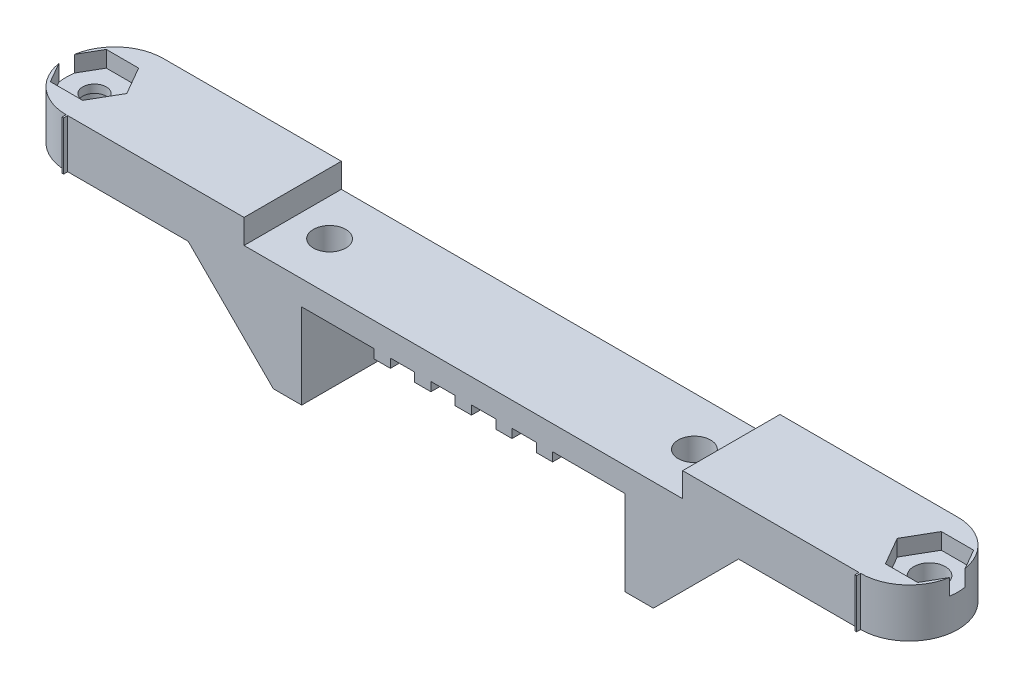
from build123d import *

# Parameters (mm, degrees)
SKETCH1_R                 = 1.95
BOSS_EXTRUDE1_DEPTH       = 3
SKETCH4_W                 = 3.5
SKETCH4_H                 = 12
BOSS_EXTRUDE3_DEPTH       = 10.5
SKETCH5_W                 = 2
SKETCH5_H                 = 12
BOSS_EXTRUDE4_DEPTH       = 1.1
SKETCH6_W                 = 0.2
SKETCH6_H                 = 3
BOSS_EXTRUDE5_DEPTH       = 0.5
CHAMFER1_SIZE             = 10.5
BOSS_EXTRUDE6_OUTLINE_R   = 1.95
BOSS_EXTRUDE6_OUTLINE_R_2 = 1.45
BOSS_EXTRUDE6_DEPTH       = 3
CUT_EXTRUDE1_START        = -2
SKETCH11_R                = 1.45
CUT_EXTRUDE1_DEPTH        = 2
SKETCH13_R                = 2
CUT_EXTRUDE2_DEPTH        = 8


# Read off the part's stored shape, not the designer's step: Boss-Extrude6
with BuildPart() as part:
    # Sketch1 → Boss-Extrude1 (new body)
    with BuildSketch(Plane(origin=(0, 0, 0), x_dir=(1, 0, 0), z_dir=(0, 1, 0))):
        with BuildLine():
            Line((-49, 6), (49, 6))
            ThreePointArc((49, 6), (55, 0), (49, -6))
            Line((49, -6), (-49, -6))
            ThreePointArc((-49, -6), (-55, 0), (-49, 6))
        make_face()
        with Locations(Location((-51.5, 0, 0), (0, 0, 270))):
            Circle(SKETCH1_R, mode=Mode.SUBTRACT)
        with Locations(Location((51.5, 0, 0), (0, 0, 270))):
            Circle(SKETCH1_R, mode=Mode.SUBTRACT)
    extrude(amount=BOSS_EXTRUDE1_DEPTH)

    # Sketch4 → Boss-Extrude3 (add)
    with BuildSketch(Plane.XZ):
        with Locations((-21.690023983, 0)):
            Rectangle(SKETCH4_W, SKETCH4_H)
        with Locations((21.690023983, 0)):
            Rectangle(SKETCH4_W, SKETCH4_H)
    extrude(amount=BOSS_EXTRUDE3_DEPTH)

    # Sketch5 → Boss-Extrude4 (add)
    with BuildSketch(Plane.XZ):
        with Locations((5, 0)):
            Rectangle(SKETCH5_W, SKETCH5_H)
        Rectangle(SKETCH5_W, SKETCH5_H)
        with Locations((10, 0)):
            Rectangle(SKETCH5_W, SKETCH5_H)
        with Locations((-5, 0)):
            Rectangle(SKETCH5_W, SKETCH5_H)
        with Locations((-10, 0)):
            Rectangle(SKETCH5_W, SKETCH5_H)
    extrude(amount=BOSS_EXTRUDE4_DEPTH)

    # Sketch6 → Boss-Extrude5 (add)
    with BuildSketch(Plane.XY.offset(6)):
        with Locations((48.9, 1.5)):
            Rectangle(SKETCH6_W, SKETCH6_H)
        with Locations((-48.9, 1.5)):
            Rectangle(SKETCH6_W, SKETCH6_H)
    extrude(amount=BOSS_EXTRUDE5_DEPTH)

    # Chamfer1
    chamfer1_edges = [part.edges().sort_by_distance(p)[0] for p in [
        (23.440023983, 0, 0),
        (-23.440023983, 0, 0),
    ]]
    chamfer(chamfer1_edges, length=CHAMFER1_SIZE - 0.0001)  # a hair under: the kernel refuses the full size

    # Boss-Extrude6 outline → Boss-Extrude6 (add)
    # profile 1 of 2: a face of its own
    with BuildSketch(Plane(origin=(0, 3, 0), x_dir=(1, 0, 0), z_dir=(0, 1, 0))):
        with BuildLine():
            Line((27.05, -6), (48.8, -6))
            Line((48.8, -6), (48.8, -6.5))
            Line((48.8, -6.5), (49, -6.5))
            Line((49, -6.5), (49, -6))
            ThreePointArc((49, -6), (55, 0), (49, 6))
            Line((49, 6), (27.05, 6))
            Line((27.05, 6), (27.05, -6))
        make_face()
        with Locations((51.5, 0)):
            Circle(BOSS_EXTRUDE6_OUTLINE_R, mode=Mode.SUBTRACT)
    # profile 2 of 2: a face of its own
    with BuildSketch(Plane(origin=(0, 3, 0), x_dir=(1, 0, 0), z_dir=(0, 1, 0))):
        with BuildLine():
            Line((-48.8, -6), (-27.05, -6))
            Line((-27.05, -6), (-27.05, 6))
            Line((-27.05, 6), (-49, 6))
            ThreePointArc((-49, 6), (-55, 0), (-49, -6))
            Line((-49, -6), (-49, -6.5))
            Line((-49, -6.5), (-48.8, -6.5))
            Line((-48.8, -6.5), (-48.8, -6))
        make_face()
        with Locations((-51.5, 0)):
            Circle(BOSS_EXTRUDE6_OUTLINE_R_2, mode=Mode.SUBTRACT)
    extrude(amount=BOSS_EXTRUDE6_DEPTH)

    # Sketch11 → Cut-Extrude1 (cut)
    # profile 1 of 2: a face of its own
    with BuildSketch(Plane(origin=(0, 6, 0), x_dir=(1, 0, 0), z_dir=(0, 1, 0)).offset(CUT_EXTRUDE1_START)):
        Polygon((53.491858429, 3.45), (55.483716857, 0), (53.491858429, -3.45), (49.508141571, -3.45), (47.516283143, 0), (49.508141571, 3.45), align=None)
    # profile 2 of 2: a face of its own
    with BuildSketch(Plane(origin=(0, 6, 0), x_dir=(1, 0, 0), z_dir=(0, 1, 0)).offset(CUT_EXTRUDE1_START)):
        Polygon((-47.516283143, 0), (-49.508141571, 3.45), (-53.491858429, 3.45), (-55.483716857, 0), (-53.491858429, -3.45), (-49.508141571, -3.45), align=None)
        with Locations(Location((-51.5, 0, 0), (0, 0, 270))):
            Circle(SKETCH11_R, mode=Mode.SUBTRACT)
    extrude(amount=CUT_EXTRUDE1_DEPTH, mode=Mode.SUBTRACT)

    # Sketch13 → Cut-Extrude2 (cut)
    with BuildSketch(Plane(origin=(0, 3, 0), x_dir=(1, 0, 0), z_dir=(0, 1, 0))):
        with Locations(Location((22.5, 0, 0), (0, 0, 270))):
            Circle(SKETCH13_R)
        with Locations(Location((-22.5, 0, 0), (0, 0, 270))):
            Circle(SKETCH13_R)
    extrude(amount=-CUT_EXTRUDE2_DEPTH, mode=Mode.SUBTRACT)


solid = part.part
